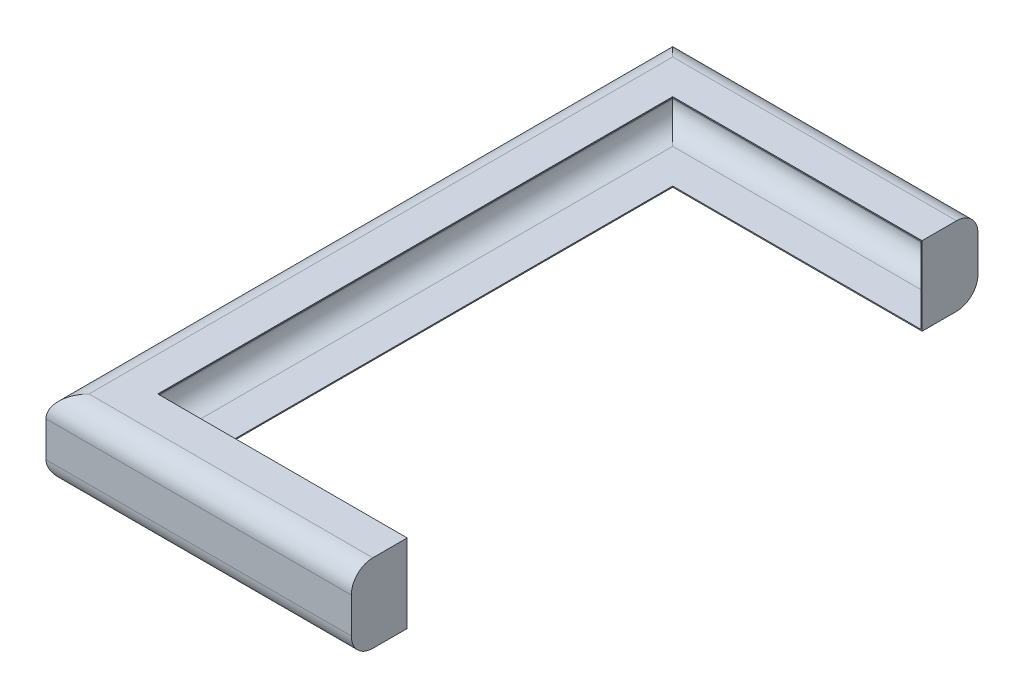
from build123d import *

# Parameters (mm, degrees)
BOSS_EXTRUDE1_DEPTH = 57.94375
FILLET1_R           = 31.75
SHELL1_T            = -1.5875


with BuildPart() as part:
    # Sketch1 → Boss-Extrude1 (new, symmetric)
    with BuildSketch(Plane(origin=(0, 0, 0), x_dir=(1, 0, 0), z_dir=(0, 1, 0))):
        Polygon((368.3, 380.2126), (0, 380.2126), (0, -380.2126), (368.3, -380.2126), (368.3, -462.7626), (-82.55, -462.7626), (-82.55, 462.7626), (368.3, 462.7626), align=None)
    extrude(amount=BOSS_EXTRUDE1_DEPTH, both=True)

    # Fillet1
    fillet1_edges = [part.edges().sort_by_distance(p)[0] for p in [
        (142.875, -57.94375, 462.7626),
        (-82.55, -57.94375, 0),
        (142.875, -57.94375, -462.7626),
        (142.875, 57.94375, -462.7626),
        (-82.55, 57.94375, 0),
        (142.875, 57.94375, 462.7626),
    ]]
    fillet(fillet1_edges, radius=FILLET1_R)

    # Shell1
    shell1_openings = [part.faces().sort_by_distance(p)[0] for p in [
        (184.15, 0, -380.2126),
        (184.15, 0, 380.2126),
        (0, 0, 0),
    ]]
    offset(amount=SHELL1_T, openings=shell1_openings)


solid = part.part
